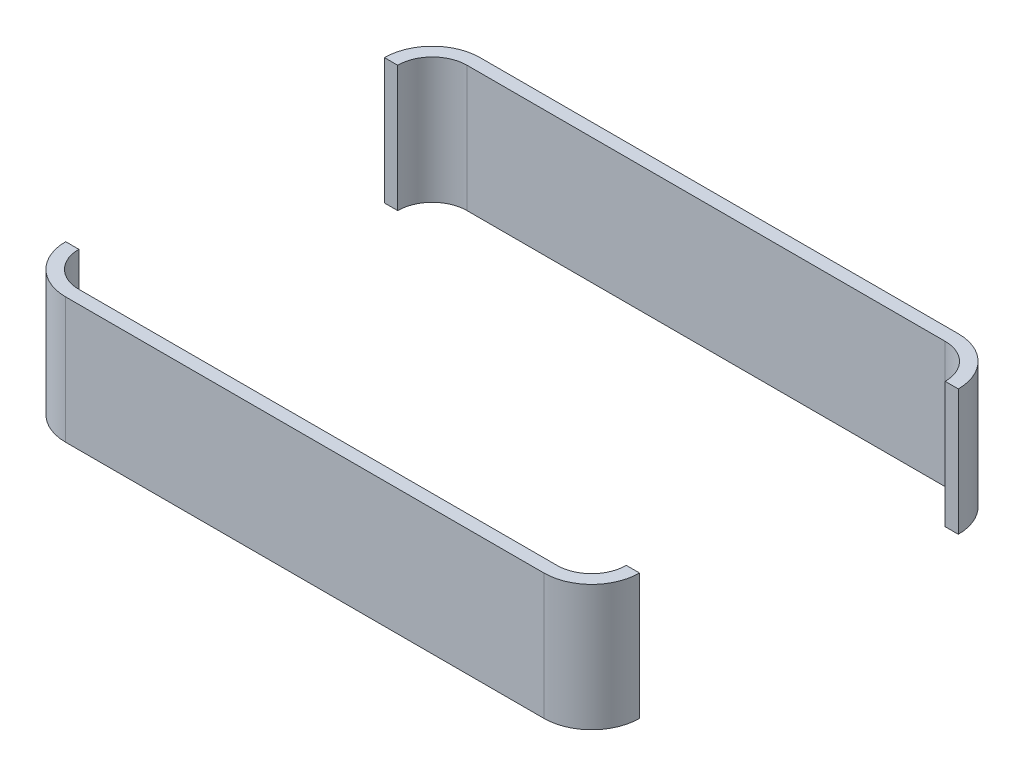
from build123d import *

# Parameters (mm, degrees)
BOSS_EXTRUDE1_DEPTH      = 16
BOSS_EXTRUDE2_DEPTH      = 46.583974855
BOSS_EXTRUDE2_DEPTH_BACK = 46.58397486
SKETCH4_R                = 3.3
CUT_EXTRUDE1_DEPTH       = 32.2
CUT_EXTRUDE1_DEPTH_BACK  = 32.2
SKETCH5_R                = 3.3
SKETCH6_W                = 20
SKETCH6_H                = 11
BOSS_EXTRUDE3_DEPTH      = 30
CUT_EXTRUDE2_DEPTH       = 233.824504724
CUT_EXTRUDE2_DEPTH_BACK  = 233.824504724
SKETCH7_R                = 2
SKETCH8_W                = 40
SKETCH8_H                = 11
CUT_EXTRUDE3_DEPTH       = 40
SKETCH9_R                = 2
CUT_EXTRUDE4_DEPTH       = 40
FILLET1_R                = 20
BOSS_EXTRUDE4_DEPTH      = 52.66666667
SKETCH11_W               = 287.599331825
SKETCH11_H               = 200.78083169
CUT_EXTRUDE5_DEPTH       = 16
SCALE1_START             = 16
SCALE1_DEPTH             = 52.66666667
SCALE1_START_2           = 2.833333333
SCALE1_2_DEPTH           = 79.000000004
SKETCH15_W               = 527.18296214
SKETCH15_H               = 284.392361206
CUT_EXTRUDE9_DEPTH       = 200


# Read off the part's stored shape, not the designer's step: Scale1
with BuildPart() as part:
    # Sketch1 → Boss-Extrude1 (new body)
    with BuildSketch(Plane(origin=(0, 0, 0), x_dir=(1, 0, 0), z_dir=(0, 1, 0))):
        Polygon((-120, -37.5), (-120, -75), (0, -75), (0, 75), (-120, 75), (-120, 37.5), (-220, 37.5), (-220, -37.5), align=None)
    extrude(amount=BOSS_EXTRUDE1_DEPTH)

    # Sketch4 → Boss-Extrude2 (add, two sides: drawn at the far end of the back side and taken through both)
    # profile 1 of 2: a face of its own
    with BuildSketch(Plane.ZY.offset(170).offset(-BOSS_EXTRUDE2_DEPTH_BACK)):
        with BuildLine():
            Line((37.5, 16), (43.5, 16))
            ThreePointArc((43.5, 16), (51.5, 8), (43.5, 0))
            Line((43.5, 0), (37.5, 0))
            Line((37.5, 0), (37.5, 16))
        make_face()
        with Locations((43.5, 8)):
            Circle(SKETCH4_R, mode=Mode.SUBTRACT)
    # profile 2 of 2: a face of its own
    with BuildSketch(Plane.ZY.offset(170).offset(-BOSS_EXTRUDE2_DEPTH_BACK)):
        with BuildLine():
            Line((-37.5, 0), (-43.5, 0))
            ThreePointArc((-43.5, 0), (-51.5, 8), (-43.5, 16))
            Line((-43.5, 16), (-37.5, 16))
            Line((-37.5, 16), (-37.5, 0))
        make_face()
        with Locations((-43.5, 8)):
            Circle(SKETCH4_R, mode=Mode.SUBTRACT)
    extrude(amount=BOSS_EXTRUDE2_DEPTH + BOSS_EXTRUDE2_DEPTH_BACK)

    # Sketch5 → Cut-Extrude1 (cut, two sides: drawn at the far end of the back side and taken through both)
    # profile 1 of 2: a face of its own
    with BuildSketch(Plane.ZY.offset(170).offset(-CUT_EXTRUDE1_DEPTH_BACK)):
        with BuildLine():
            Line((-43.5, 16), (-37.5, 16))
            Line((-37.5, 16), (-37.5, 0))
            Line((-37.5, 0), (-43.5, 0))
            ThreePointArc((-43.5, 0), (-51.5, 8), (-43.5, 16))
        make_face()
        with Locations((-43.5, 8)):
            Circle(SKETCH5_R, mode=Mode.SUBTRACT)
    # profile 2 of 2: a face of its own
    with BuildSketch(Plane.ZY.offset(170).offset(-CUT_EXTRUDE1_DEPTH_BACK)):
        with BuildLine():
            Line((37.5, 0), (43.5, 0))
            ThreePointArc((43.5, 0), (51.5, 8), (43.5, 16))
            Line((43.5, 16), (37.5, 16))
            Line((37.5, 16), (37.5, 0))
        make_face()
        with Locations((43.5, 8)):
            Circle(SKETCH5_R, mode=Mode.SUBTRACT)
    extrude(amount=CUT_EXTRUDE1_DEPTH + CUT_EXTRUDE1_DEPTH_BACK, mode=Mode.SUBTRACT)

    # Sketch6 → Boss-Extrude3 (add)
    with BuildSketch(Plane(origin=(0, 0, 0), x_dir=(0, 0, -1), z_dir=(1, 0, 0))):
        with Locations((-50, 8)):
            Rectangle(SKETCH6_W, SKETCH6_H)
        with Locations((50, 8)):
            Rectangle(SKETCH6_W, SKETCH6_H)
    extrude(amount=BOSS_EXTRUDE3_DEPTH)

    # Sketch7 → Cut-Extrude2 (cut, two sides: drawn at the far end of the back side and taken through both)
    with BuildSketch(Plane(origin=(0, 13.5, 0), x_dir=(1, 0, 0), z_dir=(0, 1, 0)).offset(-CUT_EXTRUDE2_DEPTH_BACK)):
        with Locations(Location((22.5, 50, 0), (0, 0, 270))):
            Circle(SKETCH7_R)
        with Locations(Location((22.5, -50, 0), (0, 0, 270))):
            Circle(SKETCH7_R)
    extrude(amount=CUT_EXTRUDE2_DEPTH + CUT_EXTRUDE2_DEPTH_BACK, mode=Mode.SUBTRACT)

    # Sketch8 → Cut-Extrude3 (cut)
    with BuildSketch(Plane(origin=(0, 0, 0), x_dir=(0, 0, -1), z_dir=(1, 0, 0))):
        with Locations((0, 8)):
            Rectangle(SKETCH8_W, SKETCH8_H)
    extrude(amount=-CUT_EXTRUDE3_DEPTH, mode=Mode.SUBTRACT)

    # Sketch9 → Cut-Extrude4 (cut)
    with BuildSketch(Plane(origin=(0, 16, 0), x_dir=(1, 0, 0), z_dir=(0, 1, 0))):
        with Locations(Location((-32.5, 0, 0), (0, 0, 270))):
            Circle(SKETCH9_R)
    extrude(amount=-CUT_EXTRUDE4_DEPTH, mode=Mode.SUBTRACT)

    # Fillet1
    # the kernel refuses this fillet: 20 mm, written as the material it takes off along each edge
    with BuildSketch(Plane(origin=(-220, -27.947694226, -37.5), x_dir=(0, 0, 1), z_dir=(0, 1, 0))) as fillet1_piece_1:
        with BuildLine():
            CenterArc((11.17907769, 20), FILLET1_R, 236.01651728, 33.98348272)
            Line((0, 3.416025145), (-0.223581554, 3.084345648))
            ThreePointArc((-0.223581554, 3.084345648), (-0.4, 1.708012572), (-0.4, 0))
            Line((-0.4, 0), (0, -0.4))
            Line((0, -0.4), (11.17907769, -0.4))
            Line((11.17907769, -0.4), (11.17907769, 0))
        make_face()
    extrude(amount=71.895388452, mode=Mode.SUBTRACT)
    with BuildSketch(Plane(origin=(-220, -27.947694226, 37.5), x_dir=(1, 0, 0), z_dir=(0, 1, 0))) as fillet1_piece_2:
        with BuildLine():
            CenterArc((20, 11.17907769), FILLET1_R, 180, 33.98348272)
            Line((0, 11.17907769), (-0.4, 11.17907769))
            Line((-0.4, 11.17907769), (-0.4, 0))
            Line((-0.4, 0), (0, -0.4))
            ThreePointArc((0, -0.4), (1.708012572, -0.4), (3.084345648, -0.223581554))
            Line((3.084345648, -0.223581554), (3.416025145, 0))
        make_face()
    extrude(amount=71.895388452, mode=Mode.SUBTRACT)
    with BuildSketch(Plane(origin=(-120, -50, -75), x_dir=(1, 0, 0), z_dir=(0, 1, 0)), Plane(origin=(-120, -50, 75), x_dir=(0, 0, -1), z_dir=(0, 1, 0))) as fillet1_piece_3:
        with BuildLine():
            CenterArc((FILLET1_R, -FILLET1_R), FILLET1_R, 90, 90)
            Line((0, -FILLET1_R), (-FILLET1_R * 0.02, -FILLET1_R))
            Line((-FILLET1_R * 0.02, -FILLET1_R), (-FILLET1_R * 0.02, FILLET1_R * 0.02))
            Line((-FILLET1_R * 0.02, FILLET1_R * 0.02), (FILLET1_R, FILLET1_R * 0.02))
            Line((FILLET1_R, FILLET1_R * 0.02), (FILLET1_R, 0))
        make_face()
    extrude(amount=116, mode=Mode.SUBTRACT)

    # Sketch10 → Boss-Extrude4 (add)
    with BuildSketch(Plane(origin=(0, 16, 0), x_dir=(1, 0, 0), z_dir=(0, 1, 0))):
        with BuildLine():
            Line((0, 69.5), (-100, 69.5))
            ThreePointArc((-100, 69.5), (-110.253048327, 65.253048327), (-114.5, 55))
            Line((-114.5, 55), (-120, 55))
            ThreePointArc((-120, 55), (-114.142135624, 69.142135624), (-100, 75))
            Line((-100, 75), (0, 75))
            Line((0, 75), (100, 75))
            ThreePointArc((100, 75), (114.142135624, 69.142135624), (120, 55))
            Line((120, 55), (114.5, 55))
            ThreePointArc((114.5, 55), (110.253048327, 65.253048327), (100, 69.5))
            Line((100, 69.5), (0, 69.5))
        make_face()
        with BuildLine():
            Line((0, -75), (100, -75))
            ThreePointArc((100, -75), (114.142135624, -69.142135624), (120, -55))
            Line((120, -55), (114.5, -55))
            ThreePointArc((114.5, -55), (110.253048327, -65.253048327), (100, -69.5))
            Line((100, -69.5), (0, -69.5))
            Line((0, -69.5), (-100, -69.5))
            ThreePointArc((-100, -69.5), (-110.253048327, -65.253048327), (-114.5, -55))
            Line((-114.5, -55), (-120, -55))
            ThreePointArc((-120, -55), (-114.142135624, -69.142135624), (-100, -75))
            Line((-100, -75), (0, -75))
        make_face()
    extrude(amount=BOSS_EXTRUDE4_DEPTH)

    # Sketch11 → Cut-Extrude5 (cut)
    with BuildSketch(Plane.XZ):
        with Locations((-109.164099046, 3.949352656)):
            Rectangle(SKETCH11_W, SKETCH11_H)
    extrude(amount=-CUT_EXTRUDE5_DEPTH, mode=Mode.SUBTRACT)


with BuildPart() as cut_extrude5_piece_1:
    # of the separate pieces the step leaves, piece 1, a body of its own (cut_extrude5_pieces)
    add(part.part.solids().sort_by_distance((-100, 16, 75))[0])


with BuildPart() as cut_extrude5_piece_2:
    # of the separate pieces the step leaves, piece 2, a body of its own (cut_extrude5_pieces)
    add(part.part.solids().sort_by_distance((-114.5, 16, -55))[0])


with BuildPart() as scale1_tool:
    # Scale1 outline → Scale1 (new body)
    with BuildSketch(Plane(origin=(0, 0, 0), x_dir=(1, 0, 0), z_dir=(0, 1, 0)).offset(SCALE1_START)):
        with BuildLine():
            Line((104.502391105, -68.783267912), (114.492119434, -68.783267912))
            ThreePointArc((114.492119434, -68.783267912), (118.572054123, -62.421509662), (120, -55))
            Line((120, -55), (114.5, -55))
            ThreePointArc((114.5, -55), (111.737433088, -63.513675146), (104.502391105, -68.783267912))
        make_face()
        with BuildLine():
            Line((-114.492119434, -68.783267912), (-104.502391105, -68.783267912))
            ThreePointArc((-104.502391105, -68.783267912), (-111.737433088, -63.513675146), (-114.5, -55))
            Line((-114.5, -55), (-120, -55))
            ThreePointArc((-120, -55), (-118.572054123, -62.421509662), (-114.492119434, -68.783267912))
        make_face()
        with BuildLine():
            Line((-104.502391105, 68.783267912), (-114.492119434, 68.783267912))
            ThreePointArc((-114.492119434, 68.783267912), (-118.572054123, 62.421509662), (-120, 55))
            Line((-120, 55), (-114.5, 55))
            ThreePointArc((-114.5, 55), (-111.737433088, 63.513675146), (-104.502391105, 68.783267912))
        make_face()
        with BuildLine():
            ThreePointArc((120, 55), (118.572054123, 62.421509662), (114.492119434, 68.783267912))
            Line((114.492119434, 68.783267912), (104.502391105, 68.783267912))
            ThreePointArc((104.502391105, 68.783267912), (111.737433088, 63.513675146), (114.5, 55))
            Line((114.5, 55), (120, 55))
        make_face()
    extrude(amount=SCALE1_DEPTH)


with BuildPart() as cut_extrude5_piece_1_1:
    add(cut_extrude5_piece_1.part)

    # Scale1: cut by scale1_tool
    add(scale1_tool.part, mode=Mode.SUBTRACT)



with BuildPart() as cut_extrude5_piece_2_1:
    add(cut_extrude5_piece_2.part)

    # Scale1: cut by scale1_tool
    add(scale1_tool.part, mode=Mode.SUBTRACT)


with BuildPart() as cut_extrude5_piece_1_2:
    add(cut_extrude5_piece_1_1.part)

    add(cut_extrude5_piece_2_1.part)  # Scale1 2 merges Cut-Extrude5 piece 2
    # Scale1 2 outline → Scale1 2 (add)
    with BuildSketch(Plane(origin=(0, 0, 0), x_dir=(1, 0, 0), z_dir=(0, 1, 0)).offset(SCALE1_START_2)):
        with BuildLine():
            Line((180, -47.033267912), (171.75, -47.033267912))
            ThreePointArc((171.75, -47.033267912), (165.379572491, -62.412840403), (150, -68.783267912))
            Line((150, -68.783267912), (-150, -68.783267912))
            ThreePointArc((-150, -68.783267912), (-165.379572491, -62.412840403), (-171.75, -47.033267912))
            Line((-171.75, -47.033267912), (-180, -47.033267912))
            ThreePointArc((-180, -47.033267912), (-171.213203436, -68.246471348), (-150, -77.033267912))
            Line((-150, -77.033267912), (150, -77.033267912))
            ThreePointArc((150, -77.033267912), (171.213203436, -68.246471348), (180, -47.033267912))
        make_face()
        with BuildLine():
            Line((150, 77.033267912), (-150, 77.033267912))
            ThreePointArc((-150, 77.033267912), (-171.213203436, 68.246471348), (-180, 47.033267912))
            Line((-180, 47.033267912), (-171.75, 47.033267912))
            ThreePointArc((-171.75, 47.033267912), (-165.379572491, 62.412840403), (-150, 68.783267912))
            Line((-150, 68.783267912), (150, 68.783267912))
            ThreePointArc((150, 68.783267912), (165.379572491, 62.412840403), (171.75, 47.033267912))
            Line((171.75, 47.033267912), (180, 47.033267912))
            ThreePointArc((180, 47.033267912), (171.213203436, 68.246471348), (150, 77.033267912))
        make_face()
    extrude(amount=SCALE1_2_DEPTH)

    # Sketch15 → Cut-Extrude9 (cut)
    with BuildSketch(Plane.XY):
        with Locations((-4.944471508, 47.534491158)):
            Rectangle(SKETCH15_W, SKETCH15_H)
    extrude(amount=-CUT_EXTRUDE9_DEPTH, mode=Mode.SUBTRACT)


with BuildPart() as body_2:
    # Mirror8: mirrored copy
    add(cut_extrude5_piece_1_2.part.mirror(Plane.XY.offset(-52.966732088)))


solid = Compound([cut_extrude5_piece_1_2.part, body_2.part])
